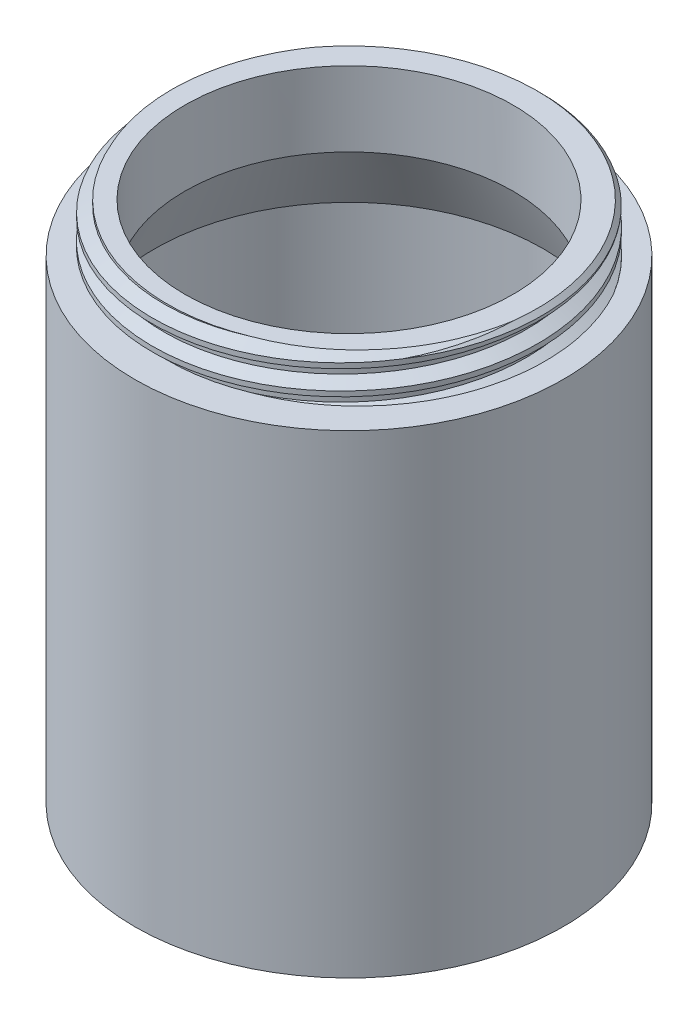
from build123d import *

# Parameters (mm, degrees)
ESQUISSE1_R        = 35.25
ESQUISSE1_R_2      = 2.5
BOSS_EXTRU_1_DEPTH = 1
ESQUISSE3_R        = 35.25
ESQUISSE3_R_2      = 32.25
BOSS_EXTRU_2_DEPTH = 77
ESQUISSE11_R       = 32
ESQUISSE11_R_2     = 27
BOSS_EXTRU_3_DEPTH = 8
BOSS_EXTRU_5_START = 15
ESQUISSE18_R       = 32.25
ESQUISSE18_R_2     = 27
BOSS_EXTRU_5_DEPTH = 15
CHANFREIN2_SIZE    = 5
CHANFREIN2_SIZE2   = 10.722534603
CHANFREIN3_SIZE    = 1
FILETAGE3_PITCH    = 4
FILETAGE3_TO       = 17


with BuildPart() as part:
    # Esquisse1 → Boss.-Extru.1 (new body)
    with BuildSketch(Plane(origin=(0, 0, 0), x_dir=(1, 0, 0), z_dir=(0, 1, 0))):
        with Locations(Location((0, 0, 0), (0, 0, 270))):
            Circle(ESQUISSE1_R)
        with Locations(Location((0, 0, 0), (0, 0, 270))):
            Circle(ESQUISSE1_R_2, mode=Mode.SUBTRACT)
    extrude(amount=BOSS_EXTRU_1_DEPTH)

    # Esquisse3 → Boss.-Extru.2 (add)
    with BuildSketch(Plane(origin=(0, 1, 0), x_dir=(1, 0, 0), z_dir=(0, 1, 0))):
        with Locations(Location((0, 0, 0), (0, 0, 270))):
            Circle(ESQUISSE3_R)
        with Locations(Location((0, 0, 0), (0, 0, 270))):
            Circle(ESQUISSE3_R_2, mode=Mode.SUBTRACT)
    extrude(amount=BOSS_EXTRU_2_DEPTH)



with BuildPart() as body_2:
    # Esquisse11 → Boss.-Extru.3 (new body)
    with BuildSketch(Plane(origin=(0, 78, 0), x_dir=(1, 0, 0), z_dir=(0, 1, 0))):
        with Locations(Location((0, 0, 0), (0, 0, 270))):
            Circle(ESQUISSE11_R)
        with Locations(Location((0, 0, 0), (0, 0, 270))):
            Circle(ESQUISSE11_R_2, mode=Mode.SUBTRACT)
    extrude(amount=BOSS_EXTRU_3_DEPTH)


with BuildPart() as part_1:
    add(part.part)

    add(body_2.part)  # Boss.-Extru.5 merges body 2
    # Esquisse18 → Boss.-Extru.5 (add)
    with BuildSketch(Plane.XZ.offset(-78).offset(BOSS_EXTRU_5_START)):
        with Locations(Location((0, 0, 0), (0, 0, 270))):
            Circle(ESQUISSE18_R)
        with Locations(Location((0, 0, 0), (0, 0, 90))):
            Circle(ESQUISSE18_R_2, mode=Mode.SUBTRACT)
    extrude(amount=-BOSS_EXTRU_5_DEPTH)

    # Chanfrein2
    chanfrein2_edges = [part_1.edges().sort_by_distance(p)[0] for p in [
        (0, 63, -27),
    ]]
    chanfrein2_side = [part_1.faces().sort_by_distance(p)[0] for p in [
        (0, 63, -31.337832252),
    ]]
    chamfer(chanfrein2_edges, length=CHANFREIN2_SIZE, length2=CHANFREIN2_SIZE2, reference=chanfrein2_side[0])

    # Chanfrein3
    chanfrein3_edges = [part_1.edges().sort_by_distance(p)[0] for p in [
        (0, 86, -32),
    ]]
    chamfer(chanfrein3_edges, length=CHANFREIN3_SIZE)

    # Filetage3: arcs per turn and ends read off the stored shape
    # Filetage3: the profile of Profil de filetage3 profile screwed along a right-hand helix through 4.25 turns, 12 arcs to a turn; built about Z, then put on its axis
    filetage3_z = Axis((0, 0, 0), (0, 0, 1))
    filetage3_corners = [(32.0003, 0, -0.000173205), (32.0003, 0, 3.500173194), (29.8349365, 0, 2.249999995), (29.8349365, 0, 1.249999995)]
    with BuildLine(mode=Mode.PRIVATE) as filetage3_profile:
        Line(filetage3_corners[0], filetage3_corners[1])
        Line(filetage3_corners[1], filetage3_corners[2])
        Line(filetage3_corners[2], filetage3_corners[3])
        Line(filetage3_corners[3], filetage3_corners[0])
    filetage3_cap = Face(filetage3_profile.wire())
    filetage3_turn_angles = [0, 15, 30, 45, 60, 75, 90, 105, 120, 135, 150, 165, 180, 195, 210, 225, 240, 255, 270, 285, 300, 315, 330, 345, 360]
    filetage3_turn_weights = [1, 0.9659258262890683, 1, 0.9659258262890683, 1, 0.9659258262890683, 1, 0.9659258262890683, 1, 0.9659258262890683, 1, 0.9659258262890683, 1, 0.9659258262890683, 1, 0.9659258262890683, 1, 0.9659258262890683, 1, 0.9659258262890683, 1, 0.9659258262890683, 1, 0.9659258262890683, 1]
    filetage3_turn_rails = [Edge.make_bspline([Vector(p[0], p[1], 0).rotate(filetage3_z, filetage3_turn_angles[k]) / filetage3_turn_weights[k] + Vector(0, 0, p[2] + FILETAGE3_PITCH * filetage3_turn_angles[k] / 360) for k in range(25)], [0, 0, 0, 1, 1, 2, 2, 3, 3, 4, 4, 5, 5, 6, 6, 7, 7, 8, 8, 9, 9, 10, 10, 11, 11, 12, 12, 12], 2, filetage3_turn_weights) for p in filetage3_corners]
    filetage3_turn_sides = [Face.make_surface_from_curves(filetage3_turn_rails[p[0]], filetage3_turn_rails[p[1]]) for p in [(0, 1), (1, 2), (2, 3), (3, 0)]]
    filetage3_last_angles = [1440, 1455, 1470, 1485, 1500, 1515, 1530]
    filetage3_last_weights = [1, 0.9659258262890683, 1, 0.9659258262890683, 1, 0.9659258262890734, 1]
    filetage3_last_rails = [Edge.make_bspline([Vector(p[0], p[1], 0).rotate(filetage3_z, filetage3_last_angles[k]) / filetage3_last_weights[k] + Vector(0, 0, p[2] + FILETAGE3_PITCH * filetage3_last_angles[k] / 360) for k in range(7)], [0, 0, 0, 1, 1, 2, 2, 3, 3, 3], 2, filetage3_last_weights) for p in filetage3_corners]
    filetage3_last_sides = [Face.make_surface_from_curves(filetage3_last_rails[p[0]], filetage3_last_rails[p[1]]) for p in [(0, 1), (1, 2), (2, 3), (3, 0)]]
    filetage3 = Plane(origin=(0, 95, 0), x_dir=(-1, 0, 0), z_dir=(0, -1, 0)) * split(Solid(Shell([*[p.moved(Location((0, 0, FILETAGE3_PITCH * i))) for i in range(4) for p in filetage3_turn_sides], *filetage3_last_sides, filetage3_cap, filetage3_cap.rotate(filetage3_z, 1530).moved(Location((0, 0, FILETAGE3_PITCH * 1530 / 360)))])), bisect_by=Plane.XY.offset(FILETAGE3_TO), keep=Keep.BOTTOM, mode=Mode.PRIVATE)
    add(filetage3, mode=Mode.SUBTRACT)

    # Dépouille1: read off the stored shape, not the designer's step
    # Dépouille1 outline → Dépouille1 (revolve, cut)
    with BuildSketch(Plane.XY):
        Polygon((31.702253463, 85.297753255), (31.727727531, 78), (32, 78), (32, 85.297753255), align=None)
    revolve(axis=Axis((0, 0, 0), (0, 1, 0)), mode=Mode.SUBTRACT)


solid = part_1.part
